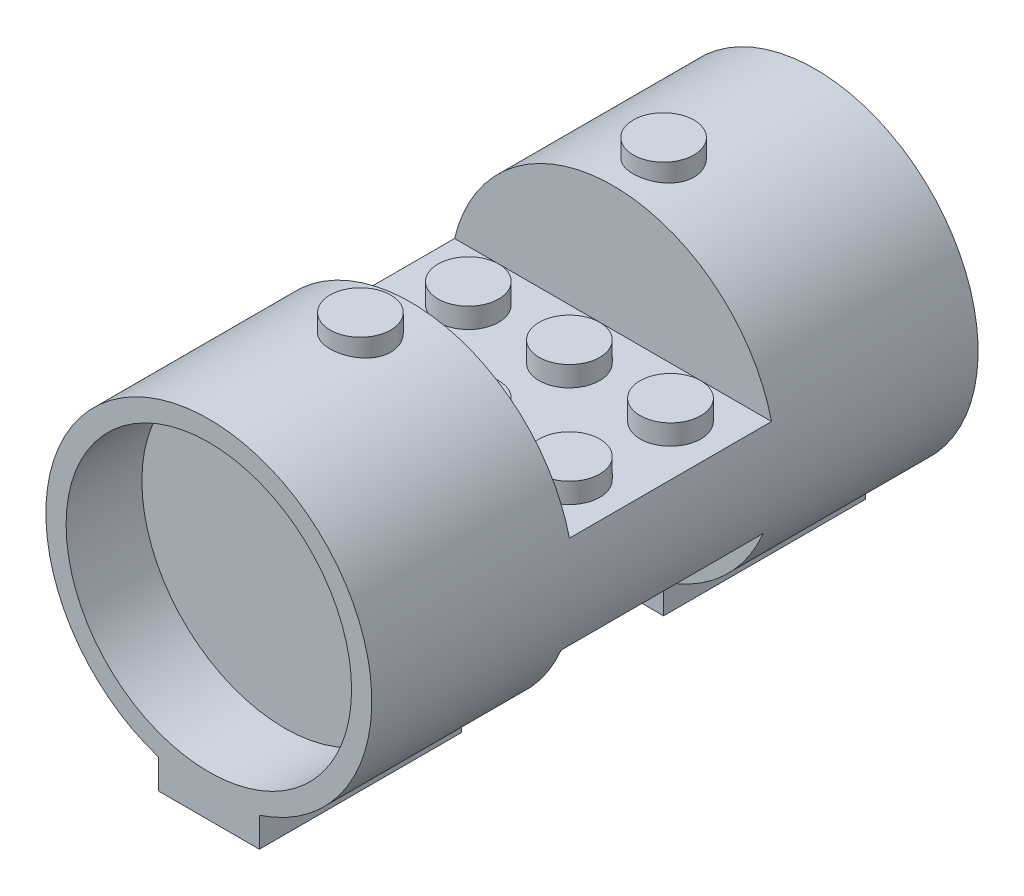
from build123d import *

# Parameters (mm, degrees)
SKETCH3_R            = 12.9
BOSS_EXTRUDE3_DEPTH  = 24
SKETCH5_W            = 8
SKETCH5_H            = 24
BOSS_EXTRUDE4_DEPTH  = 6
SKETCH7_R            = 2.4
BOSS_EXTRUDE5_DEPTH  = 28.8
SKETCH6_R            = 11.3
CUT_EXTRUDE1_DEPTH   = 6
REFERENCEW_W         = 23.783187338
REFERENCEW_H         = 9.6
REFERENCEW_W_2       = 25.0926284
REFERENCEW_H_2       = 9.9
CUT_EXTRUDE2_DEPTH   = 8
SKETCH8_R            = 2.4
BOSS_EXTRUDE6_DEPTH  = 1.6
LPATTERN1_COUNT      = 3
LPATTERN1_PITCH      = 8
LPATTERN1_COUNT_DIR2 = 2
LPATTERN1_PITCH_DIR2 = 8
SKETCH9_W            = 20.583187338
SKETCH9_H            = 12.8
CUT_EXTRUDE3_DEPTH   = 1.6
SHELL1_START         = -14.6
SHELL1_OUTLINE_W     = 4.8
SHELL1_OUTLINE_H     = 6.8
SHELL1_DEPTH         = 17.6
SHELL1_2_OUTLINE_W   = 4.8
SHELL1_2_OUTLINE_H   = 6
SHELL1_2_DEPTH       = 1.7
SHELL1_START_2       = -1.8
SHELL1_3_OUTLINE_R   = 0.8
SHELL1_3_DEPTH       = 4.8
SHELL1_START_3       = 3
SHELL1_4_OUTLINE_R   = 0.8
SHELL1_4_DEPTH       = 9.6
SHELL1_START_4       = -16.4
SHELL1_5_DEPTH       = 6.8
SHELL1_START_5       = 9.6
SHELL1_6_DEPTH       = 6.8
SHELL1_START_6       = -9.6
SHELL1_7_DEPTH       = 19.2
SHELL1_8_DEPTH       = 1.6
SHELL1_START_7       = 8
SHELL1_9_DEPTH       = 1.6
SHELL1_START_8       = -22.4
SHELL1_10_DEPTH      = 6
SHELL1_START_9       = 16.4
SHELL1_11_DEPTH      = 6


with BuildPart() as part:
    # Sketch3 → Boss-Extrude3 (new body)
    with BuildSketch(Plane.XY):
        Circle(SKETCH3_R)
    boss_extrude3 = extrude(amount=BOSS_EXTRUDE3_DEPTH)

    # Sketch5 → Boss-Extrude4 (add)
    with BuildSketch(Plane(origin=(0, -14.6, 0), x_dir=(1, 0, 0), z_dir=(0, 1, 0))):
        with Locations((0, -12)):
            Rectangle(SKETCH5_W, SKETCH5_H)
    boss_extrude4 = extrude(amount=BOSS_EXTRUDE4_DEPTH)

    # Sketch7 → Boss-Extrude5 (add)
    with BuildSketch(Plane.XZ.offset(14.6)):
        with Locations(Location((0, 12, 0), (0, 0, 270))):
            Circle(SKETCH7_R)
    boss_extrude5 = extrude(amount=-BOSS_EXTRUDE5_DEPTH)

    # Sketch6 → Cut-Extrude1 (cut)
    with BuildSketch(Plane.XY.offset(24)):
        Circle(SKETCH6_R)
    cut_extrude1 = extrude(amount=-CUT_EXTRUDE1_DEPTH, mode=Mode.SUBTRACT)

    # referencew → Cut-Extrude2 (cut)
    with BuildSketch(Plane(origin=(0, 0, 0), x_dir=(-1, 0, 0), z_dir=(0, 0, -1))):
        with Locations((0, -9.8)):
            Rectangle(REFERENCEW_W, REFERENCEW_H)
        with Locations((0, 7.95)):
            Rectangle(REFERENCEW_W_2, REFERENCEW_H_2)
    cut_extrude2 = extrude(amount=-CUT_EXTRUDE2_DEPTH, mode=Mode.SUBTRACT)

    # Mirror1: Boss-Extrude3, Boss-Extrude4, Boss-Extrude5, Cut-Extrude1, Cut-Extrude2 across Front Plane
    add(boss_extrude3.mirror(Plane.XY))
    add(boss_extrude4.mirror(Plane.XY))
    add(boss_extrude5.mirror(Plane.XY))
    add(cut_extrude1.mirror(Plane.XY), mode=Mode.SUBTRACT)
    add(cut_extrude2.mirror(Plane.XY), mode=Mode.SUBTRACT)

    # Sketch8 → Boss-Extrude6 (add)
    with BuildSketch(Plane(origin=(0, 3, 0), x_dir=(1, 0, 0), z_dir=(0, 1, 0))):
        with Locations(Location((8.5463142, 4, 0), (0, 0, 90))):
            Circle(SKETCH8_R)
    boss_extrude6 = extrude(amount=BOSS_EXTRUDE6_DEPTH)

    # LPattern1: Boss-Extrude6 3 × 2
    with Locations(*[(-i * LPATTERN1_PITCH, 0, j * LPATTERN1_PITCH_DIR2) for i in range(LPATTERN1_COUNT) for j in range(LPATTERN1_COUNT_DIR2) if (i, j) != (0, 0)]):
        add(boss_extrude6)

    # Sketch9 → Cut-Extrude3 (cut)
    with BuildSketch(Plane.XZ.offset(5)):
        Rectangle(SKETCH9_W, SKETCH9_H)
    extrude(amount=-CUT_EXTRUDE3_DEPTH, mode=Mode.SUBTRACT)

    # Shell1: read off the stored shape, not the designer's step
    # Shell1 outline → Shell1 (cut)
    with BuildSketch(Plane(origin=(0, 0, 0), x_dir=(1, 0, 0), z_dir=(0, 1, 0)).offset(SHELL1_START)):
        with Locations((0, 13)):
            Rectangle(SHELL1_OUTLINE_W, SHELL1_OUTLINE_H)
        with Locations((0, -13)):
            Rectangle(SHELL1_OUTLINE_W, SHELL1_OUTLINE_H)
    extrude(amount=SHELL1_DEPTH, mode=Mode.SUBTRACT)

    # Shell1 2 outline → Shell1 2 (cut)
    with BuildSketch(Plane(origin=(0, 0, 0), x_dir=(1, 0, 0), z_dir=(0, 1, 0)).offset(SHELL1_START)):
        with Locations((0, 19.4)):
            Rectangle(SHELL1_2_OUTLINE_W, SHELL1_2_OUTLINE_H)
        with Locations((0, -19.4)):
            Rectangle(SHELL1_2_OUTLINE_W, SHELL1_2_OUTLINE_H)
    extrude(amount=SHELL1_2_DEPTH, mode=Mode.SUBTRACT)

    # Shell1 3 outline → Shell1 3 (cut)
    with BuildSketch(Plane(origin=(0, 0, 0), x_dir=(1, 0, 0), z_dir=(0, 1, 0)).offset(SHELL1_START_2)):
        with Locations((8.5463142, 4)):
            Circle(SHELL1_3_OUTLINE_R)
        with Locations((8.5463142, -4)):
            Circle(SHELL1_3_OUTLINE_R)
        with Locations((0.5463142, 4)):
            Circle(SHELL1_3_OUTLINE_R)
        with Locations((0.5463142, -4)):
            Circle(SHELL1_3_OUTLINE_R)
        with Locations((-7.4536858, 4)):
            Circle(SHELL1_3_OUTLINE_R)
        with Locations((-7.4536858, -4)):
            Circle(SHELL1_3_OUTLINE_R)
    extrude(amount=SHELL1_3_DEPTH, mode=Mode.SUBTRACT)

    # Shell1 4 outline → Shell1 4 (cut)
    with BuildSketch(Plane(origin=(0, 0, 0), x_dir=(1, 0, 0), z_dir=(0, 1, 0)).offset(SHELL1_START_3)):
        with Locations((0, -12)):
            Circle(SHELL1_4_OUTLINE_R)
        with Locations((0, 12)):
            Circle(SHELL1_4_OUTLINE_R)
    extrude(amount=SHELL1_4_DEPTH, mode=Mode.SUBTRACT)

    # Shell1 5 outline → Shell1 5 (cut)
    with BuildSketch(Plane.XY.offset(SHELL1_START_4)):
        with BuildLine():
            Line((-2.4, -11.042191811), (-2.4, 3))
            Line((-2.4, 3), (2.4, 3))
            Line((2.4, 3), (2.4, -11.042191811))
            ThreePointArc((2.4, -11.042191811), (0, 11.3), (-2.4, -11.042191811))
        make_face()
    extrude(amount=SHELL1_5_DEPTH, mode=Mode.SUBTRACT)

    # Shell1 6 outline → Shell1 6 (cut)
    with BuildSketch(Plane.XY.offset(SHELL1_START_5)):
        with BuildLine():
            Line((-2.4, -11.042191811), (-2.4, 3))
            Line((-2.4, 3), (2.4, 3))
            Line((2.4, 3), (2.4, -11.042191811))
            ThreePointArc((2.4, -11.042191811), (0, 11.3), (-2.4, -11.042191811))
        make_face()
    extrude(amount=SHELL1_6_DEPTH, mode=Mode.SUBTRACT)

    # Shell1 7 outline → Shell1 7 (cut)
    with BuildSketch(Plane.XY.offset(SHELL1_START_6)):
        with BuildLine():
            ThreePointArc((-11.212938954, 1.4), (-11.298193722, -0.202036175), (-11.155716023, -1.8))
            Line((-11.155716023, -1.8), (11.155716023, -1.8))
            ThreePointArc((11.155716023, -1.8), (11.298193722, -0.202036175), (11.212938954, 1.4))
            Line((11.212938954, 1.4), (-11.212938954, 1.4))
        make_face()
    extrude(amount=SHELL1_7_DEPTH, mode=Mode.SUBTRACT)

    # Shell1 8 outline → Shell1 8 (cut)
    with BuildSketch(Plane.XY.offset(SHELL1_START_6)):
        with BuildLine():
            ThreePointArc((-11.155716023, -1.8), (-10.9951818, -2.606909506), (-10.776363023, -3.4))
            Line((-10.776363023, -3.4), (10.776363023, -3.4))
            ThreePointArc((10.776363023, -3.4), (10.9951818, -2.606909506), (11.155716023, -1.8))
            Line((11.155716023, -1.8), (-11.155716023, -1.8))
        make_face()
    extrude(amount=SHELL1_8_DEPTH, mode=Mode.SUBTRACT)

    # Shell1 9 outline → Shell1 9 (cut)
    with BuildSketch(Plane.XY.offset(SHELL1_START_7)):
        with BuildLine():
            ThreePointArc((-11.155716023, -1.8), (-10.9951818, -2.606909506), (-10.776363023, -3.4))
            Line((-10.776363023, -3.4), (10.776363023, -3.4))
            ThreePointArc((10.776363023, -3.4), (10.9951818, -2.606909506), (11.155716023, -1.8))
            Line((11.155716023, -1.8), (-11.155716023, -1.8))
        make_face()
    extrude(amount=SHELL1_9_DEPTH, mode=Mode.SUBTRACT)

    # Shell1 10 outline → Shell1 10 (cut)
    with BuildSketch(Plane.XY.offset(SHELL1_START_8)):
        with BuildLine():
            ThreePointArc((0, -12.9), (-1.205272262, -12.843571107), (-2.4, -12.674778105))
            Line((-2.4, -12.674778105), (-2.4, -12.9))
            Line((-2.4, -12.9), (0, -12.9))
        make_face()
        with BuildLine():
            ThreePointArc((2.4, -12.674778105), (1.205272262, -12.843571107), (0, -12.9))
            Line((0, -12.9), (2.4, -12.9))
            Line((2.4, -12.9), (2.4, -12.674778105))
        make_face()
    extrude(amount=SHELL1_10_DEPTH, mode=Mode.SUBTRACT)

    # Shell1 11 outline → Shell1 11 (cut)
    with BuildSketch(Plane.XY.offset(SHELL1_START_9)):
        with BuildLine():
            ThreePointArc((0, -12.9), (-1.205272262, -12.843571107), (-2.4, -12.674778105))
            Line((-2.4, -12.674778105), (-2.4, -12.9))
            Line((-2.4, -12.9), (0, -12.9))
        make_face()
        with BuildLine():
            ThreePointArc((2.4, -12.674778105), (1.205272262, -12.843571107), (0, -12.9))
            Line((0, -12.9), (2.4, -12.9))
            Line((2.4, -12.9), (2.4, -12.674778105))
        make_face()
    extrude(amount=SHELL1_11_DEPTH, mode=Mode.SUBTRACT)


solid = part.part
